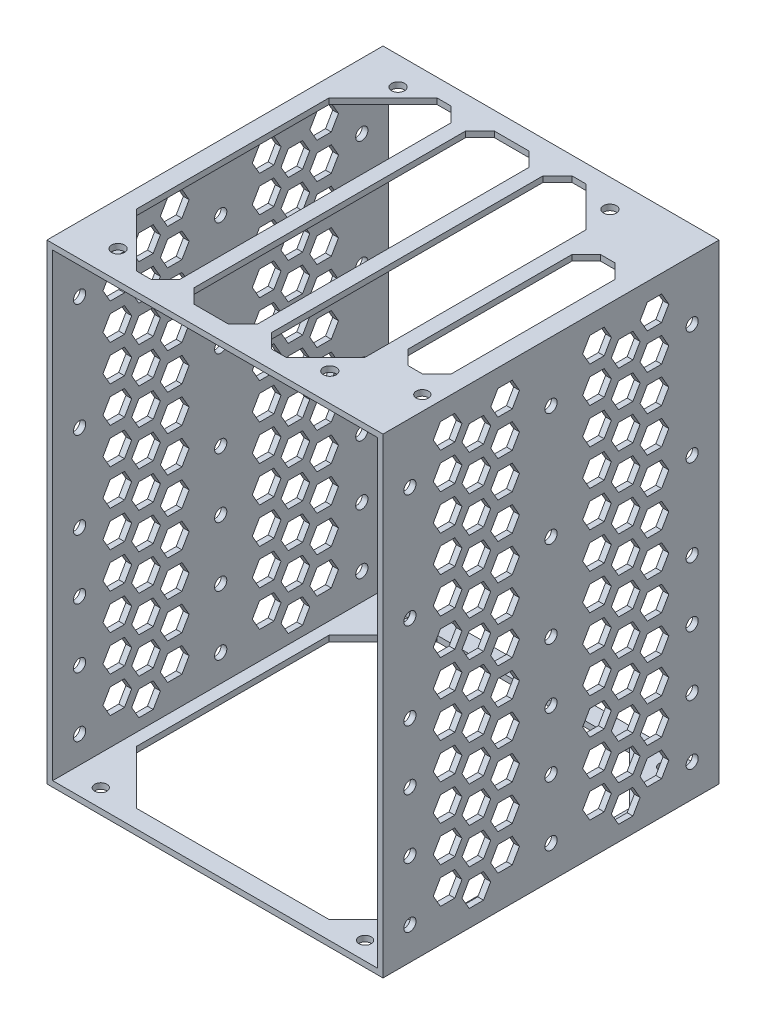
from build123d import *

# Parameters (mm, degrees)
SKETCH1_W                = 93.6
SKETCH1_H                = 131.2
SKETCH1_W_2              = 90.4
SKETCH1_H_2              = 128
BOSS_EXTRUDE1_DEPTH      = 93.6
SKETCH2_R                = 0.75
CUT_EXTRUDE1_DEPTH       = 100
CUT_EXTRUDE4_DEPTH       = 100
M3_CLEARANCE_HOLE1_D     = 3.4
M3_CLEARANCE_HOLE2_D     = 3.4
M3_CLEARANCE_HOLE2_DEPTH = 1.6
LPATTERN1_COUNT          = 12
LPATTERN1_PITCH          = 10
SKETCH16_R               = 1.7
CUT_EXTRUDE6_DEPTH       = 141
M3_CLEARANCE_HOLE3_D     = 3.6
M3_CLEARANCE_HOLE3_DEPTH = 1.6
SKETCH19_W               = 17.6
SKETCH19_H               = 83.6
SKETCH19_W_2             = 12
SKETCH19_H_2             = 53.6
CUT_EXTRUDE7_DEPTH       = 1.6
CHAMFER1_SIZE            = 4
CUT_EXTRUDE8_DEPTH       = 10


with BuildPart() as part:
    # Sketch1 → Boss-Extrude1 (new body)
    with BuildSketch(Plane.XY):
        with Locations((0, -37.15998137)):
            Rectangle(SKETCH1_W, SKETCH1_H)
        with Locations((0, -37.15998137)):
            Rectangle(SKETCH1_W_2, SKETCH1_H_2, mode=Mode.SUBTRACT)
    extrude(amount=BOSS_EXTRUDE1_DEPTH)

    # Sketch2 → Cut-Extrude1 (cut)
    with BuildSketch(Plane(origin=(46.8, 0, 0), x_dir=(0, 0, -1), z_dir=(1, 0, 0))):
        with Locations(Location((-86.1, 11.84001863, 0), (0, 0, 90))):
            Circle(SKETCH2_R)
        with Locations(Location((-86.1, -19.75998137, 0), (0, 0, 90))):
            Circle(SKETCH2_R)
        with Locations(Location((-86.1, -43.85998137, 0), (0, 0, 90))):
            Circle(SKETCH2_R)
        with Locations(Location((-86.1, -60.45998137, 0), (0, 0, 90))):
            Circle(SKETCH2_R)
        with Locations(Location((-86.1, -77.05998137, 0), (0, 0, 90))):
            Circle(SKETCH2_R)
        with Locations(Location((-86.1, -93.65998137, 0), (0, 0, 90))):
            Circle(SKETCH2_R)
        with Locations(Location((-7.5, 11.84001863, 0), (0, 0, 90))):
            Circle(SKETCH2_R)
        with Locations(Location((-7.5, -19.75998137, 0), (0, 0, 90))):
            Circle(SKETCH2_R)
        with Locations(Location((-7.5, -43.85998137, 0), (0, 0, 90))):
            Circle(SKETCH2_R)
        with Locations(Location((-7.5, -60.45998137, 0), (0, 0, 90))):
            Circle(SKETCH2_R)
        with Locations(Location((-7.5, -77.05998137, 0), (0, 0, 90))):
            Circle(SKETCH2_R)
        with Locations(Location((-7.5, -93.65998137, 0), (0, 0, 90))):
            Circle(SKETCH2_R)
        with Locations(Location((-46.8, 11.84001863, 0), (0, 0, 90))):
            Circle(SKETCH2_R)
        with Locations(Location((-46.8, -19.75998137, 0), (0, 0, 90))):
            Circle(SKETCH2_R)
        with Locations(Location((-46.8, -43.85998137, 0), (0, 0, 90))):
            Circle(SKETCH2_R)
        with Locations(Location((-46.8, -60.45998137, 0), (0, 0, 90))):
            Circle(SKETCH2_R)
        with Locations(Location((-46.8, -77.05998137, 0), (0, 0, 90))):
            Circle(SKETCH2_R)
        with Locations(Location((-46.8, -93.65998137, 0), (0, 0, 90))):
            Circle(SKETCH2_R)
    extrude(amount=-CUT_EXTRUDE1_DEPTH, mode=Mode.SUBTRACT)

    # Sketch6 → Cut-Extrude4 (cut)
    with BuildSketch(Plane(origin=(46.8, 0, 0), x_dir=(0, 0, -1), z_dir=(1, 0, 0))):
        Polygon((-79.6, 19.975917015), (-77.6, 23.44001863), (-73.6, 23.44001863), (-71.6, 19.975917015), (-73.6, 16.5118154), (-77.6, 16.5118154), align=None)
        Polygon((-71.6, 15.475917015), (-69.6, 18.94001863), (-65.6, 18.94001863), (-63.6, 15.475917015), (-65.6, 12.0118154), (-69.6, 12.0118154), align=None)
        Polygon((-63.6, 19.975917015), (-61.6, 23.44001863), (-57.6, 23.44001863), (-55.6, 19.975917015), (-57.6, 16.5118154), (-61.6, 16.5118154), align=None)
        Polygon((-38, 19.975917015), (-36, 23.44001863), (-32, 23.44001863), (-30, 19.975917015), (-32, 16.5118154), (-36, 16.5118154), align=None)
        Polygon((-30, 14.975917015), (-28, 18.44001863), (-24, 18.44001863), (-22, 14.975917015), (-24, 11.5118154), (-28, 11.5118154), align=None)
        Polygon((-22, 19.975917015), (-20, 23.44001863), (-16, 23.44001863), (-14, 19.975917015), (-16, 16.5118154), (-20, 16.5118154), align=None)
    cut_extrude4 = extrude(amount=-CUT_EXTRUDE4_DEPTH, mode=Mode.SUBTRACT)

    # M3 Clearance Hole1 (through all)
    with Locations(Plane.ZY.offset(46.8)):
        with Locations((7.5, 11.84001863), (86.1, 11.84001863), (7.5, -19.75998137), (7.5, -43.85998137), (86.1, -19.75998137), (86.1, -43.85998137), (86.1, -60.45998137), (86.1, -77.05998137), (7.5, -93.65998137), (7.5, -77.05998137), (7.5, -60.45998137), (86.1, -93.65998137), (46.8, -77.05998137), (46.8, -93.65998137), (46.8, -60.45998137), (46.8, -43.85998137), (46.8, -19.75998137), (46.8, 11.84001863)):
            Hole(M3_CLEARANCE_HOLE1_D / 2)

    # M3 Clearance Hole2
    with Locations(Plane(origin=(0, -102.75998137, 0), x_dir=(-1, 0, 0), z_dir=(0, -1, 0))):
        with Locations((-36.8, -5), (-36.8, -88.6), (36.8, -88.6), (36.8, -5)):
            Hole(M3_CLEARANCE_HOLE2_D / 2, depth=M3_CLEARANCE_HOLE2_DEPTH)

    # LPattern1: Cut-Extrude4 ×12
    with Locations(*[(0, -i * LPATTERN1_PITCH, 0) for i in range(1, LPATTERN1_COUNT)]):
        add(cut_extrude4, mode=Mode.SUBTRACT)

    # Sketch16 → Cut-Extrude6 (cut)
    with BuildSketch(Plane(origin=(0, 28.44001863, 0), x_dir=(1, 0, 0), z_dir=(0, 1, 0))):
        with Locations(Location((42.75, -78.6, 0), (0, 0, 180))):
            Circle(SKETCH16_R)
    extrude(amount=-CUT_EXTRUDE6_DEPTH, mode=Mode.SUBTRACT)

    # M3 Clearance Hole3
    with Locations(Plane(origin=(0, 28.44001863, 0), x_dir=(1, 0, 0), z_dir=(0, 1, 0))):
        with Locations((-34.8, -7.8), (-34.8, -85.8), (24.2, -85.8), (24.2, -7.8)):
            Hole(M3_CLEARANCE_HOLE3_D / 2, depth=M3_CLEARANCE_HOLE3_DEPTH)

    # Sketch19 → Cut-Extrude7 (cut)
    with BuildSketch(Plane(origin=(0, 28.44001863, 0), x_dir=(1, 0, 0), z_dir=(0, 1, 0))):
        Polygon((-18.8, -5), (-26.8, -5), (-41.8, -20), (-41.8, -73.6), (-26.8, -88.6), (-18.8, -88.6), align=None)
        with Locations((-6, -46.8)):
            Rectangle(SKETCH19_W, SKETCH19_H)
        Polygon((14.8, -5), (6.8, -5), (6.8, -88.6), (14.8, -88.6), (25.8, -77.6), (25.8, -16), align=None)
        with Locations((35.8, -46.8)):
            Rectangle(SKETCH19_W_2, SKETCH19_H_2)
    extrude(amount=-CUT_EXTRUDE7_DEPTH, mode=Mode.SUBTRACT)

    # Chamfer1
    chamfer1_edges = [part.edges().sort_by_distance(p)[0] for p in [
        (-18.8, 27.64001863, 5),
        (-18.8, 27.64001863, 88.6),
        (2.8, 27.64001863, 5),
        (2.8, 27.64001863, 88.6),
        (-14.8, 27.64001863, 88.6),
        (-14.8, 27.64001863, 5),
        (6.8, 27.64001863, 88.6),
        (6.8, 27.64001863, 5),
        (29.8, 27.64001863, 73.6),
        (29.8, 27.64001863, 20),
        (41.8, 27.64001863, 20),
        (41.8, 27.64001863, 73.6),
    ]]
    chamfer(chamfer1_edges, length=CHAMFER1_SIZE)

    # Sketch20 → Cut-Extrude8 (cut)
    with BuildSketch(Plane.XZ.offset(102.75998137)):
        Polygon((-41.8, 20), (-26.8, 5), (26.8, 5), (41.8, 20), (41.8, 73.6), (26.8, 88.6), (-26.8, 88.6), (-41.8, 73.6), align=None)
    extrude(amount=-CUT_EXTRUDE8_DEPTH, mode=Mode.SUBTRACT)


solid = part.part
